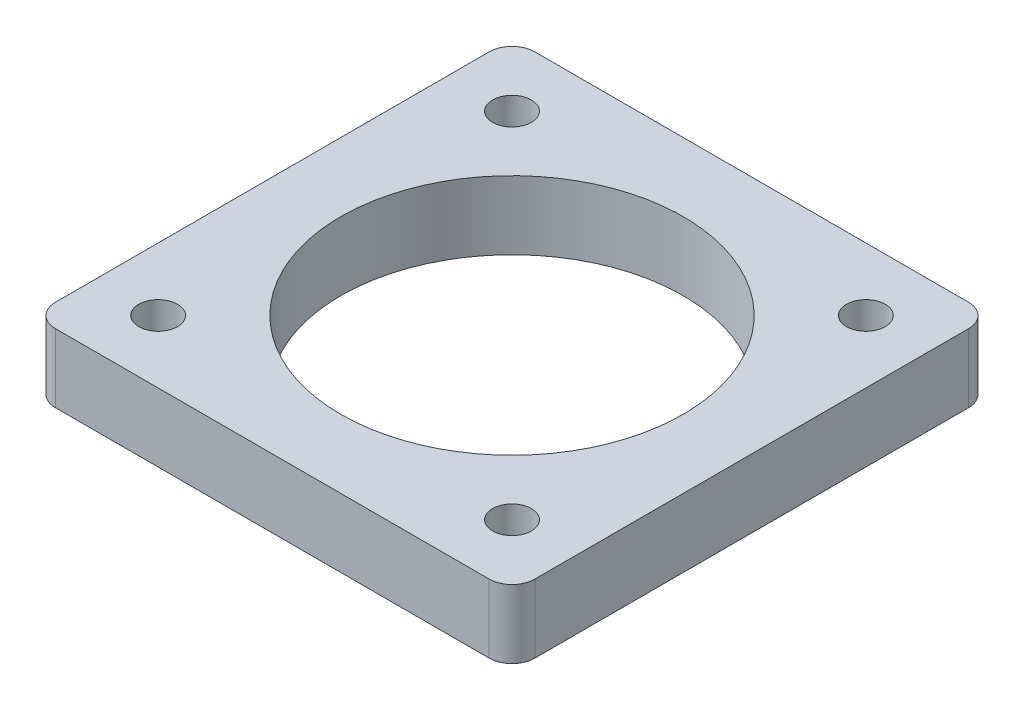
from build123d import *

# Parameters (mm, degrees)
SKETCH_1_W                 = 42
SKETCH_1_H                 = 42
SKETCH_1_R                 = 15
EXTRUDE_1_DEPTH            = 6
FILLET_1_R                 = 2
HOLE_WIZARD_M3_1_OUTLINE_R = 1.7
HOLE_WIZARD_M3_1_DEPTH     = 6


# Read off the part's stored shape, not the designer's step: M3 间隙孔1
with BuildPart() as part:
    # 草图1 → 凸台-拉伸1 (new body)
    with BuildSketch(Plane(origin=(0, 0, 0), x_dir=(1, 0, 0), z_dir=(0, 1, 0))):
        with Locations((21, 21)):
            Rectangle(SKETCH_1_W, SKETCH_1_H)
        with Locations(Location((21, 21, 0), (0, 0, 270))):
            Circle(SKETCH_1_R, mode=Mode.SUBTRACT)
    extrude(amount=EXTRUDE_1_DEPTH)

    # 圆角1
    fillet_1_edges = [part.edges().sort_by_distance(p)[0] for p in [
        (0, 3, -42),
        (42, 3, -42),
        (42, 3, 0),
        (0, 3, 0),
    ]]
    fillet(fillet_1_edges, radius=FILLET_1_R)

    # M3 间隙孔1 outline → M3 间隙孔1 (cut)
    with BuildSketch(Plane(origin=(0, 0, 0), x_dir=(1, 0, 0), z_dir=(0, 1, 0))):
        with Locations((36.5, 36.5)):
            Circle(HOLE_WIZARD_M3_1_OUTLINE_R)
        with Locations((5.5, 5.5)):
            Circle(HOLE_WIZARD_M3_1_OUTLINE_R)
        with Locations((36.5, 5.5)):
            Circle(HOLE_WIZARD_M3_1_OUTLINE_R)
        with Locations((5.5, 36.5)):
            Circle(HOLE_WIZARD_M3_1_OUTLINE_R)
    extrude(amount=HOLE_WIZARD_M3_1_DEPTH, mode=Mode.SUBTRACT)


solid = part.part
